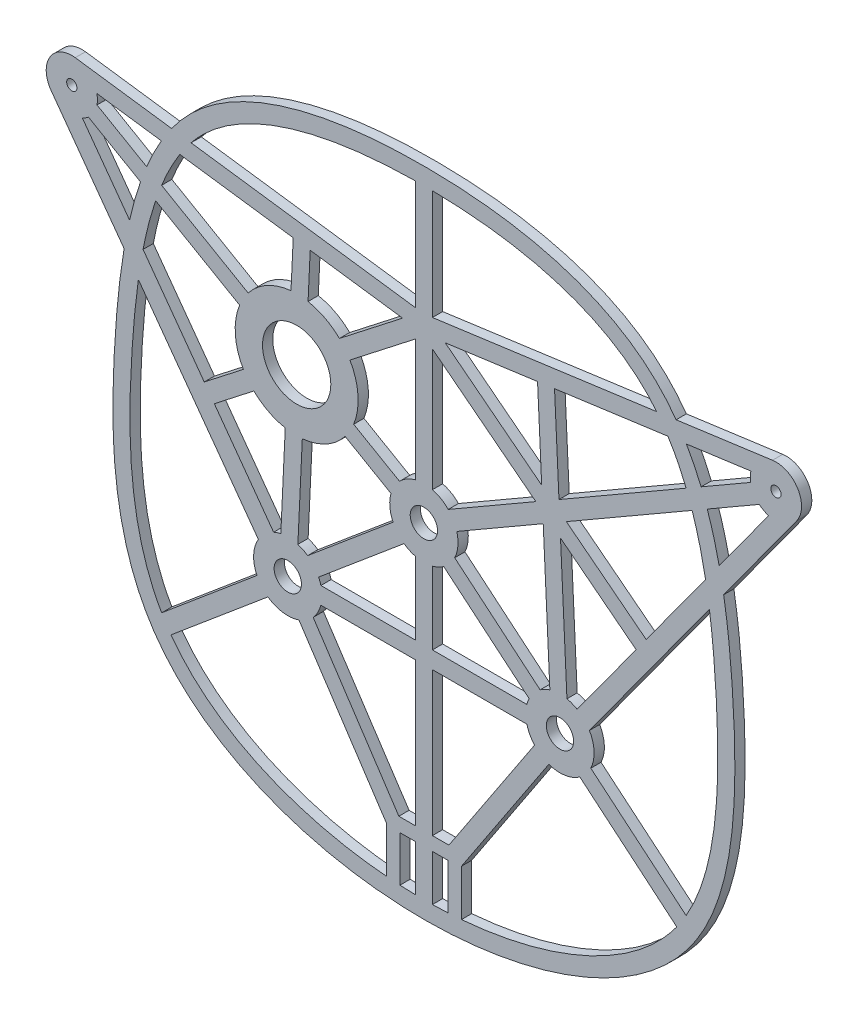
from build123d import *

# Parameters (mm, degrees)
SKETCH_1_R      = 4
SKETCH_1_R_2    = 1.5
SKETCH_1_R_3    = 10
EXTRUDE_1_DEPTH = 3
EXTRUDE_2_DEPTH = 3


# Read off the part's stored shape, not the designer's step: 凸台-拉伸2
with BuildPart() as part:
    # 草图1 → 凸台-拉伸1 (new body)
    with BuildSketch(Plane.XY):
        with BuildLine():
            Line((-2.5, 53.341305487), (-102.042517278, 66.931068432))
            ThreePointArc((-102.042517278, 66.931068432), (-109.493866136, 63.349292284), (-109.123538595, 55.090080597))
            Line((-109.123538595, 55.090080597), (-48.458796526, -28.363508268))
            ThreePointArc((-48.458796526, -28.363508268), (-49.825226404, -32.998798192), (-48.858473493, -37.733608865))
            Line((-48.858473493, -37.733608865), (-76.760213664, -61.145948751))
            ThreePointArc((-76.760213664, -61.145948751), (-77.505885896, -64.629749955), (-74.022084692, -65.375422188))
            Line((-74.022084692, -65.375422188), (-45.644535445, -41.56383108))
            ThreePointArc((-45.644535445, -41.56383108), (-41.268722982, -43.321544125), (-36.573936178, -42.878524117))
            Line((-36.573936178, -42.878524117), (-11, -81.507803322))
            Line((-11, -81.507803322), (-11, -95.036361883))
            ThreePointArc((-11, -95.036361883), (-9.138180782, -97.174542665), (-7, -95.312723448))
            Line((-7, -95.312723448), (-7, -82))
            Line((-7, -82), (-2.5, -82))
            Line((-2.5, -82), (-2.5, -95.476140268))
            ThreePointArc((-2.5, -95.476140268), (0, -97.976140268), (2.5, -95.476140268))
            Line((2.5, -95.476140268), (2.5, -82))
            Line((2.5, -82), (7, -82))
            Line((7, -82), (7, -95.312723448))
            ThreePointArc((7, -95.312723448), (9.138180782, -97.174542665), (11, -95.036361883))
            Line((11, -95.036361883), (11, -81.507803322))
            Line((11, -81.507803322), (36.573936178, -42.878524117))
            ThreePointArc((36.573936178, -42.878524117), (41.268722982, -43.321544125), (45.644535445, -41.56383108))
            Line((45.644535445, -41.56383108), (74.022084692, -65.375422188))
            ThreePointArc((74.022084692, -65.375422188), (77.505885896, -64.629749955), (76.760213664, -61.145948751))
            Line((76.760213664, -61.145948751), (48.858473493, -37.733608865))
            ThreePointArc((48.858473493, -37.733608865), (49.825226404, -32.998798192), (48.458796526, -28.363508268))
            Line((48.458796526, -28.363508268), (109.123538595, 55.090080597))
            ThreePointArc((109.123538595, 55.090080597), (109.493866136, 63.349292284), (102.042517278, 66.931068432))
            Line((102.042517278, 66.931068432), (2.5, 53.341305487))
            Line((2.5, 53.341305487), (2.5, 85.48347425))
            ThreePointArc((2.5, 85.48347425), (0, 86.519008156), (-2.5, 85.48347425))
            Line((-2.5, 85.48347425), (-2.5, 53.341305487))
        make_face()
        Circle(SKETCH_1_R, mode=Mode.SUBTRACT)
        with Locations((39.834311042, -33.424955704)):
            Circle(SKETCH_1_R, mode=Mode.SUBTRACT)
        with Locations((-39.834311042, -33.424955704)):
            Circle(SKETCH_1_R, mode=Mode.SUBTRACT)
        with Locations((-103.05702305, 59.5)):
            Circle(SKETCH_1_R_2, mode=Mode.SUBTRACT)
        with Locations((103.05702305, 59.5)):
            Circle(SKETCH_1_R_2, mode=Mode.SUBTRACT)
        with Locations((-37.239092363, 21.5)):
            Circle(SKETCH_1_R_3, mode=Mode.SUBTRACT)
        with BuildLine():
            Line((-6.244066259, 48.806072973), (-33.27173636, 52.495949818))
            Line((-33.27173636, 52.495949818), (-33.900555431, 39.187684166))
            ThreePointArc((-33.900555431, 39.187684166), (-28.956123947, 37.481002291), (-24.711147366, 34.424805382))
            Line((-24.711147366, 34.424805382), (-6.244066259, 48.806072973))
        make_face(mode=Mode.SUBTRACT)
        with BuildLine():
            Line((-99.949505222, 52.674069079), (-64.282444768, 3.608597149))
            Line((-64.282444768, 3.608597149), (-52.839133311, 12.520093408))
            ThreePointArc((-52.839133311, 12.520093408), (-55.196228816, 20.258528939), (-53.926465844, 28.247708226))
            Line((-53.926465844, 28.247708226), (-98.183298693, 53.799402585))
            ThreePointArc((-98.183298693, 53.799402585), (-99.026929927, 53.174784635), (-99.949505222, 52.674069079))
        make_face(mode=Mode.SUBTRACT)
        with BuildLine():
            Line((-95.683298693, 58.129529604), (-51.426465844, 32.577835244))
            ThreePointArc((-51.426465844, 32.577835244), (-45.868613074, 37.296562041), (-38.89498329, 39.423672203))
            Line((-38.89498329, 39.423672203), (-38.245232139, 53.174942378))
            Line((-38.245232139, 53.174942378), (-95.712775953, 61.020537595))
            ThreePointArc((-95.712775953, 61.020537595), (-95.557412878, 59.576467433), (-95.683298693, 58.129529604))
        make_face(mode=Mode.SUBTRACT)
        with BuildLine():
            Line((-23.051718881, 10.422164756), (-9.635254916, 2.676165673))
            ThreePointArc((-9.635254916, 2.676165673), (-9.961946981, -0.871557427), (-9.024162451, -4.308653161))
            Line((-9.024162451, -4.308653161), (-34.02408664, -25.286080327))
            ThreePointArc((-34.02408664, -25.286080327), (-35.395368625, -24.464163874), (-36.880108244, -23.87128176))
            Line((-36.880108244, -23.87128176), (-35.583201435, 3.576327797))
            ThreePointArc((-35.583201435, 3.576327797), (-28.609571652, 5.703437959), (-23.051718881, 10.422164756))
        make_face(mode=Mode.SUBTRACT)
        with BuildLine():
            Line((-49.767037359, 8.575194618), (-61.340889302, -0.437960243))
            Line((-61.340889302, -0.437960243), (-43.977668147, -24.323714475))
            ThreePointArc((-43.977668147, -24.323714475), (-42.945203661, -23.921148724), (-41.874536104, -23.635293723))
            Line((-41.874536104, -23.635293723), (-40.577629295, 3.812315834))
            ThreePointArc((-40.577629295, 3.812315834), (-45.522060778, 5.518997709), (-49.767037359, 8.575194618))
        make_face(mode=Mode.SUBTRACT)
        with BuildLine():
            Line((-2.5, 45.384472085), (-21.639051414, 30.479906592))
            ThreePointArc((-21.639051414, 30.479906592), (-19.281955909, 22.741471061), (-20.551718881, 14.752291774))
            Line((-20.551718881, 14.752291774), (-7.135254916, 7.006292692))
            ThreePointArc((-7.135254916, 7.006292692), (-5, 8.660254038), (-2.5, 9.682458366))
            Line((-2.5, 9.682458366), (-2.5, 45.384472085))
        make_face(mode=Mode.SUBTRACT)
        with BuildLine():
            Line((9.635254916, 2.676165673), (34.935543649, 17.283294184))
            Line((34.935543649, 17.283294184), (36.880108244, -23.87128176))
            ThreePointArc((36.880108244, -23.87128176), (35.395368625, -24.464163874), (34.02408664, -25.286080327))
            Line((34.02408664, -25.286080327), (9.024162451, -4.308653161))
            ThreePointArc((9.024162451, -4.308653161), (9.961946981, -0.871557427), (9.635254916, 2.676165673))
        make_face(mode=Mode.SUBTRACT)
        with BuildLine():
            Line((32.404793908, -40.118405872), (7.325851445, -78))
            Line((7.325851445, -78), (2.5, -78))
            Line((2.5, -78), (2.5, -35.924955704))
            Line((2.5, -35.924955704), (30.151852677, -35.924955704))
            ThreePointArc((30.151852677, -35.924955704), (31.025157709, -38.157694609), (32.404793908, -40.118405872))
        make_face(mode=Mode.SUBTRACT)
        with BuildLine():
            Line((-30.151852677, -35.924955704), (-2.5, -35.924955704))
            Line((-2.5, -35.924955704), (-2.5, -78))
            Line((-2.5, -78), (-7.325851445, -78))
            Line((-7.325851445, -78), (-32.404793908, -40.118405872))
            ThreePointArc((-32.404793908, -40.118405872), (-31.025157709, -38.157694609), (-30.151852677, -35.924955704))
        make_face(mode=Mode.SUBTRACT)
        with BuildLine():
            Line((-30.151852677, -30.924955704), (-2.5, -30.924955704))
            Line((-2.5, -30.924955704), (-2.5, -9.682458366))
            ThreePointArc((-2.5, -9.682458366), (-4.226182617, -9.06307787), (-5.810224402, -8.138875376))
            Line((-5.810224402, -8.138875376), (-30.810148591, -29.116302543))
            ThreePointArc((-30.810148591, -29.116302543), (-30.437384834, -30.00475427), (-30.151852677, -30.924955704))
        make_face(mode=Mode.SUBTRACT)
        with BuildLine():
            Line((5.810224402, -8.138875376), (30.810148591, -29.116302543))
            ThreePointArc((30.810148591, -29.116302543), (30.437384834, -30.00475427), (30.151852677, -30.924955704))
            Line((30.151852677, -30.924955704), (2.5, -30.924955704))
            Line((2.5, -30.924955704), (2.5, -9.682458366))
            ThreePointArc((2.5, -9.682458366), (4.226182617, -9.06307787), (5.810224402, -8.138875376))
        make_face(mode=Mode.SUBTRACT)
        with BuildLine():
            Line((100.921483013, 52.310461159), (65.071856379, 2.993841653))
            Line((65.071856379, 2.993841653), (41.704391699, 21.191290428))
            Line((41.704391699, 21.191290428), (98.183298693, 53.799402585))
            ThreePointArc((98.183298693, 53.799402585), (99.474191282, 52.911121756), (100.921483013, 52.310461159))
        make_face(mode=Mode.SUBTRACT)
        Polygon((6.244066259, 48.806072973), (33.27173636, 52.495949818), (34.485252803, 26.81320586), align=None, mode=Mode.SUBTRACT)
        with BuildLine():
            Line((39.542641076, 25.716705816), (95.683298693, 58.129529604))
            ThreePointArc((95.683298693, 58.129529604), (95.557412878, 59.576467433), (95.712775953, 61.020537595))
            Line((95.712775953, 61.020537595), (38.245232139, 53.174942378))
            Line((38.245232139, 53.174942378), (39.542641076, 25.716705816))
        make_face(mode=Mode.SUBTRACT)
        with BuildLine():
            Line((2.5, 45.384472085), (32.773793026, 21.808709572))
            Line((32.773793026, 21.808709572), (7.135254916, 7.006292692))
            ThreePointArc((7.135254916, 7.006292692), (5, 8.660254038), (2.5, 9.682458366))
            Line((2.5, 9.682458366), (2.5, 45.384472085))
        make_face(mode=Mode.SUBTRACT)
        with BuildLine():
            Line((39.992931923, 16.18679414), (41.874536104, -23.635293723))
            ThreePointArc((41.874536104, -23.635293723), (43.421865118, -24.090639673), (44.875861509, -24.788824111))
            Line((44.875861509, -24.788824111), (62.130300913, -1.05271574))
            Line((62.130300913, -1.05271574), (39.992931923, 16.18679414))
        make_face(mode=Mode.SUBTRACT)
    extrude(amount=EXTRUDE_1_DEPTH)

    # 凸台-拉伸2 outline → 凸台-拉伸2 (add)
    with BuildSketch(Plane.XY):
        with BuildLine():
            add(Edge.make_bspline(
                [(68.148754529, 62.303817528), (67.697867022, 62.862168525), (65.513957323, 65.444144737), (61.1355213, 69.582634847), (52.061237376, 75.692496303), (38.534942268, 81.206712567), (20.673713762, 84.658655905), (8.294526458, 85.406461009), (2.499999984, 85.48347425)],
                knots=[0.870802839, 0.870802839, 0.870802839, 0.870802839, 0.875, 0.890625, 0.90625, 0.9375, 0.96875, 0.996072016, 0.996072016, 0.996072016, 0.996072016], degree=3))
            Line((68.148754529, 62.303817528), (73.83930715, 63.080704282))
            add(Edge.make_bspline(
                [(73.83930715, 63.080704282), (72.79600612, 64.530917632), (69.849311403, 68.234676792), (64.248460202, 73.525967604), (54.33109312, 80.189945302), (39.8914002, 86.051368753), (20.449933035, 89.792551582), (6.816644345, 90.5), (0, 90.5), (-6.816644345, 90.5), (-20.449933035, 89.792551582), (-39.8914002, 86.051368753), (-54.33109312, 80.189945302), (-64.248460202, 73.525967604), (-69.849311403, 68.234676792), (-72.79600612, 64.530917632), (-73.83930715, 63.080704282)],
                knots=[0.865560321, 0.865560321, 0.865560321, 0.865560321, 0.875, 0.890625, 0.90625, 0.9375, 0.96875, 1, 1, 1, 1.03125, 1.0625, 1.09375, 1.109375, 1.125, 1.134439679, 1.134439679, 1.134439679, 1.134439679], degree=3))
            Line((-73.83930715, 63.080704282), (-68.148754529, 62.303817528))
            add(Edge.make_bspline(
                [(-2.5, 85.48347425), (-8.294526469, 85.406461008), (-20.673713767, 84.658655904), (-38.534942268, 81.206712567), (-52.061237376, 75.692496303), (-61.1355213, 69.582634847), (-65.513957323, 65.444144737), (-67.697867022, 62.862168525), (-68.148754529, 62.303817528)],
                knots=[0.003927984, 0.003927984, 0.003927984, 0.003927984, 0.03125, 0.0625, 0.09375, 0.109375, 0.125, 0.129197161, 0.129197161, 0.129197161, 0.129197161], degree=3))
            ThreePointArc((-2.5, 85.48347425), (0, 86.519008156), (2.499999984, 85.48347425))
        make_face()
        with BuildLine():
            add(Edge.make_bspline(
                [(76.760213661, -61.145948749), (77.281182554, -60.245458802), (80.343624469, -54.560186678), (84.190760778, -42.849561014), (86.24115055, -24.696990917), (86.026105919, -8.500248512), (85.226418605, 4.690270489), (84.466098979, 13.094023348), (83.831760466, 18.137964149), (83.577029277, 19.946967598)],
                knots=[0.650231307, 0.650231307, 0.650231307, 0.650231307, 0.65625, 0.6875, 0.71875, 0.75, 0.765625, 0.78125, 0.790105277, 0.790105277, 0.790105277, 0.790105277], degree=3))
            ThreePointArc((76.760213661, -61.145948749), (77.505885896, -64.629749955), (74.022084692, -65.375422188))
            add(Edge.make_bspline(
                [(11, -95.036361884), (13.967600238, -94.785073612), (23.486527008, -93.644452643), (38.950491109, -89.927496398), (55.780102299, -82.405850807), (67.157703778, -73.757887654), (72.452980321, -67.549098789), (74.022084692, -65.375422188)],
                knots=[0.517229775, 0.517229775, 0.517229775, 0.517229775, 0.53125, 0.5625, 0.59375, 0.625, 0.640501901, 0.640501901, 0.640501901, 0.640501901], degree=3))
            ThreePointArc((11, -95.036361884), (9.138180782, -97.174542665), (7, -95.312723448))
            add(Edge.make_bspline(
                [(2.5, -95.476140268), (4.00179221, -95.447472319), (5.502464906, -95.392981062), (7, -95.312723448)],
                knots=[0.503905897, 0.503905897, 0.503905897, 0.503905897, 0.510946853, 0.510946853, 0.510946853, 0.510946853], degree=3))
            ThreePointArc((2.5, -95.476140268), (0, -97.976140268), (-2.5, -95.476140268))
            add(Edge.make_bspline(
                [(-7, -95.312723448), (-5.5024649, -95.392981063), (-4.001792198, -95.447472319), (-2.5, -95.476140268)],
                knots=[0.489053147, 0.489053147, 0.489053147, 0.489053147, 0.496094103, 0.496094103, 0.496094103, 0.496094103], degree=3))
            ThreePointArc((-7, -95.312723448), (-9.138180782, -97.174542665), (-11, -95.036361883))
            add(Edge.make_bspline(
                [(-74.022084691, -65.375422187), (-72.452980321, -67.549098789), (-67.157703778, -73.757887654), (-55.780102299, -82.405850807), (-38.950491109, -89.927496398), (-23.486527008, -93.644452643), (-13.967600238, -94.785073612), (-11, -95.036361883)],
                knots=[0.359498099, 0.359498099, 0.359498099, 0.359498099, 0.375, 0.40625, 0.4375, 0.46875, 0.482770225, 0.482770225, 0.482770225, 0.482770225], degree=3))
            ThreePointArc((-74.022084691, -65.375422187), (-77.505885896, -64.629749955), (-76.760213664, -61.145948751))
            add(Edge.make_bspline(
                [(-83.577029277, 19.946967598), (-83.831760466, 18.137964149), (-84.466098979, 13.094023348), (-85.226418605, 4.690270489), (-86.026105919, -8.500248512), (-86.24115055, -24.696990917), (-84.190760778, -42.849561014), (-80.343624467, -54.560186684), (-77.281182548, -60.245458813), (-76.760213664, -61.145948751)],
                knots=[0.209894723, 0.209894723, 0.209894723, 0.209894723, 0.21875, 0.234375, 0.25, 0.28125, 0.3125, 0.34375, 0.349768693, 0.349768693, 0.349768693, 0.349768693], degree=3))
            Line((-83.577029277, 19.946967598), (-87.745778416, 25.681716727))
            add(Edge.make_bspline(
                [(-87.745778416, 25.681716727), (-88.343132564, 22.181145005), (-89.284076924, 15.338114155), (-90.213980042, 5.052354911), (-91.023425471, -8.300155003), (-91.249087195, -24.880298028), (-89.482806537, -40.668877416), (-86.314407722, -52.443657904), (-82.915098611, -60.738657928), (-78.318474543, -68.385420625), (-70.564310164, -77.478782387), (-58.291973951, -86.778310168), (-40.530617699, -94.69988391), (-20.766532663, -99.443811458), (0, -101.028094271), (20.766532663, -99.443811458), (40.530617699, -94.69988391), (58.291973951, -86.778310168), (70.564310164, -77.478782387), (78.318474543, -68.385420625), (82.915098611, -60.738657928), (86.314407722, -52.443657904), (89.482806537, -40.668877416), (91.249087195, -24.880298028), (91.023425471, -8.300155003), (90.213980042, 5.052354911), (89.284076924, 15.338114155), (88.343132564, 22.181145005), (87.745778416, 25.681716727)],
                knots=[0.201840725, 0.201840725, 0.201840725, 0.201840725, 0.21875, 0.234375, 0.25, 0.28125, 0.3125, 0.328125, 0.34375, 0.359375, 0.375, 0.40625, 0.4375, 0.46875, 0.5, 0.53125, 0.5625, 0.59375, 0.625, 0.640625, 0.65625, 0.671875, 0.6875, 0.71875, 0.75, 0.765625, 0.78125, 0.798159275, 0.798159275, 0.798159275, 0.798159275], degree=3))
            Line((87.745778416, 25.681716727), (83.577029277, 19.946967598))
        make_face()
        with BuildLine():
            Line((76.776881476, 47.213904515), (81.148135186, 49.73764904))
            add(Edge.make_bspline(
                [(81.148135186, 49.73764904), (80.800508537, 50.576932273), (79.497266322, 53.577719353), (78.019440074, 56.448175321), (76.849059231, 58.445221604)],
                knots=[0.83911863, 0.83911863, 0.83911863, 0.83911863, 0.84375, 0.855864729, 0.855864729, 0.855864729, 0.855864729], degree=3))
            Line((76.849059231, 58.445221604), (71.444795726, 57.707419689))
            add(Edge.make_bspline(
                [(76.776881476, 47.213904515), (76.374453885, 48.210815867), (74.79299303, 51.902691846), (72.95348639, 55.340231645), (71.444795726, 57.707419689)],
                knots=[0.837925295, 0.837925295, 0.837925295, 0.837925295, 0.84375, 0.859864037, 0.859864037, 0.859864037, 0.859864037], degree=3))
        make_face()
        with BuildLine():
            Line((82.451106473, 26.901646111), (86.444561778, 32.395251897))
            add(Edge.make_bspline(
                [(86.444561778, 32.395251897), (86.294020032, 33.083430222), (85.312860796, 37.405048349), (84.12428039, 41.598651984), (82.94457807, 45.001323131)],
                knots=[0.80909414, 0.80909414, 0.80909414, 0.80909414, 0.8125, 0.830575676, 0.830575676, 0.830575676, 0.830575676], degree=3))
            Line((82.94457807, 45.001323131), (78.528663247, 42.451793519))
            add(Edge.make_bspline(
                [(82.451106473, 26.901646111), (82.050497568, 29.07033495), (80.9375283, 34.416329351), (79.512810963, 39.510812399), (78.528663247, 42.451793519)],
                knots=[0.801596863, 0.801596863, 0.801596863, 0.801596863, 0.8125, 0.82887765, 0.82887765, 0.82887765, 0.82887765], degree=3))
        make_face()
        with BuildLine():
            add(Edge.make_bspline(
                [(-71.444795726, 57.707419689), (-72.95348639, 55.340231645), (-74.79299303, 51.902691846), (-76.374453885, 48.210815867), (-76.776881476, 47.213904515)],
                knots=[0.140135963, 0.140135963, 0.140135963, 0.140135963, 0.15625, 0.162074705, 0.162074705, 0.162074705, 0.162074705], degree=3))
            Line((-71.444795726, 57.707419689), (-76.84905924, 58.445221589))
            add(Edge.make_bspline(
                [(-76.84905924, 58.445221589), (-78.01944008, 56.448175311), (-79.497266324, 53.577719347), (-80.800508537, 50.576932273), (-81.148135186, 49.73764904)],
                knots=[0.144135271, 0.144135271, 0.144135271, 0.144135271, 0.15625, 0.16088137, 0.16088137, 0.16088137, 0.16088137], degree=3))
            Line((-81.148135186, 49.73764904), (-76.776881476, 47.213904515))
        make_face()
        with BuildLine():
            Line((-78.528663247, 42.451793519), (-82.94457807, 45.001323131))
            add(Edge.make_bspline(
                [(-82.94457807, 45.001323131), (-84.12428039, 41.598651984), (-85.193861246, 37.824907993), (-86.095475402, 33.947499695), (-86.153318745, 33.695314125)],
                knots=[0.169424324, 0.169424324, 0.169424324, 0.169424324, 0.1875, 0.188755149, 0.188755149, 0.188755149, 0.188755149], degree=3))
            Line((-86.153318745, 33.695314125), (-82.195363397, 28.250543919))
            add(Edge.make_bspline(
                [(-78.528663247, 42.451793519), (-79.512810963, 39.510812399), (-80.81910264, 34.839794065), (-81.863318665, 29.957338972), (-82.195363397, 28.250543919)],
                knots=[0.17112235, 0.17112235, 0.17112235, 0.17112235, 0.1875, 0.196135497, 0.196135497, 0.196135497, 0.196135497], degree=3))
        make_face()
    extrude(amount=EXTRUDE_2_DEPTH)


solid = part.part
